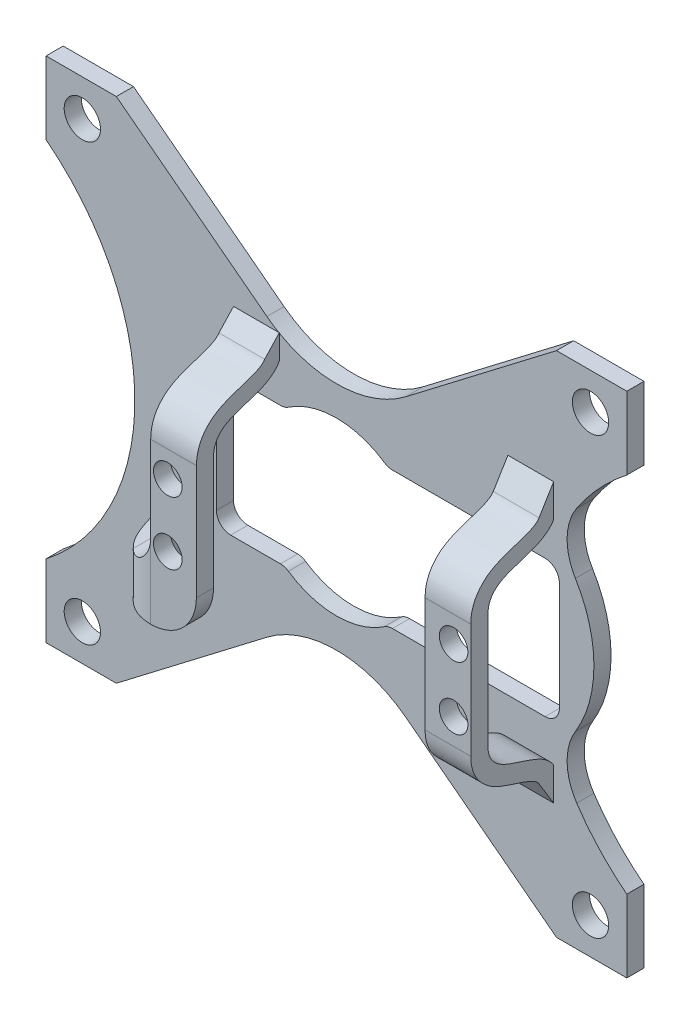
from build123d import *

# Parameters (mm, degrees)
SKETCH1_R           = 3.175
BOSS_EXTRUDE1_DEPTH = 3
SKETCH2_W           = 20
SKETCH2_H           = 3
BOSS_EXTRUDE2_DEPTH = 8
SKETCH3_W           = 3
SKETCH3_H           = 10
BOSS_EXTRUDE3_DEPTH = 8
BOSS_EXTRUDE4_DEPTH = 3
BOSS_EXTRUDE5_DEPTH = 8
FILLET1_START       = 9.218775709
FILLET1_DEPTH       = 8.281224391
FILLET1_START_2     = -10
FILLET1_2_DEPTH     = 6
FILLET2_R           = 2.5
SKETCH6_R           = 2.5
CUT_EXTRUDE1_DEPTH  = 10


with BuildPart() as part:
    # Sketch1 → Boss-Extrude1 (new body)
    with BuildSketch(Plane.XY):
        with BuildLine():
            Line((-60.325, -31.75), (-60.325, -44.45))
            Line((-60.325, -44.45), (-48.025, -44.45))
            Line((-48.025, -44.45), (-21.676299295, -24.294954915))
            ThreePointArc((-21.676299295, -24.294954915), (-9.525, -20.180354672), (2.626299295, -24.294954915))
            Line((2.626299295, -24.294954915), (28.975, -44.45))
            Line((28.975, -44.45), (41.275, -44.45))
            Line((41.275, -44.45), (41.275, -31.75))
            ThreePointArc((41.275, -31.75), (36.515027492, -27.39513634), (32.512762317, -22.33509195))
            ThreePointArc((32.512762317, -22.33509195), (30.830682399, -16.998296592), (32.278938689, -11.593360767))
            ThreePointArc((32.278938689, -11.593360767), (35.521007508, 0), (32.278938689, 11.593360767))
            ThreePointArc((32.278938689, 11.593360767), (30.830682399, 16.998296592), (32.512762317, 22.33509195))
            ThreePointArc((32.512762317, 22.33509195), (36.515027492, 27.39513634), (41.275, 31.75))
            Line((41.275, 31.75), (41.275, 44.45))
            Line((41.275, 44.45), (28.975, 44.45))
            Line((28.975, 44.45), (2.626299295, 24.294954915))
            ThreePointArc((2.626299295, 24.294954915), (-9.525, 20.180354672), (-21.676299295, 24.294954915))
            Line((-21.676299295, 24.294954915), (-48.025, 44.45))
            Line((-48.025, 44.45), (-60.325, 44.45))
            Line((-60.325, 44.45), (-60.325, 31.75))
            ThreePointArc((-60.325, 31.75), (-48.881491961, 17.673557002), (-44.789364565, 0))
            ThreePointArc((-44.789364565, 0), (-48.881491961, -17.673557002), (-60.325, -31.75))
        make_face()
        with Locations((-53.975, -38.1)):
            Circle(SKETCH1_R, mode=Mode.SUBTRACT)
        with Locations((34.925, -38.1)):
            Circle(SKETCH1_R, mode=Mode.SUBTRACT)
        with Locations((-53.975, 38.1)):
            Circle(SKETCH1_R, mode=Mode.SUBTRACT)
        with BuildLine():
            Line((-18.525, -12), (-30.525, -12))
            Line((-30.525, -12), (-30.525, 12))
            Line((-30.525, 12), (-18.525, 12))
            ThreePointArc((-18.525, 12), (-9.525, 15), (-0.525, 12))
            Line((-0.525, 12), (29.475, 12))
            Line((29.475, 12), (29.475, -12))
            Line((29.475, -12), (-0.525, -12))
            ThreePointArc((-0.525, -12), (-9.525, -15), (-18.525, -12))
        make_face(mode=Mode.SUBTRACT)
        with Locations((34.925, 38.1)):
            Circle(SKETCH1_R, mode=Mode.SUBTRACT)
    extrude(amount=BOSS_EXTRUDE1_DEPTH)

    # Sketch2 → Boss-Extrude2 (add)
    with BuildSketch(Plane.YZ.offset(20.475)):
        with BuildLine():
            Line((10, 17.5), (10, 14.5))
            add(Edge.make_bspline(
                [(10, 14.5), (16.044635902, 14.437929649), (14.184736767, 5.689745318), (18.589920917, 3)],
                knots=[0, 0, 0, 0, 1, 1, 1, 1], degree=3))
            Line((18.589920917, 3), (24.346709493, 3))
            Line((24.346709493, 3), (20.153292557, 5.560443148))
            add(Edge.make_bspline(
                [(10.030804376, 17.499841844), (10.580284275, 17.494199418), (11.690825904, 17.381169352), (13.744868646, 16.699236551), (15.740064205, 15.05007217), (17.01264364, 12.797944804), (17.78675167, 10.651473672), (18.380074772, 8.685818255), (18.969741662, 7.060430969), (19.488563299, 6.172247499), (19.869226233, 5.760648886), (20.051080137, 5.622852657), (20.153292557, 5.560443148)],
                knots=[0, 0, 0, 0, 0.0625, 0.125, 0.25, 0.375, 0.5, 0.625, 0.75, 0.875, 0.9375, 1, 1, 1, 1], degree=3))
            Line((10.030804376, 17.499841844), (10, 17.5))
        make_face()
        with Locations((0, 16)):
            Rectangle(SKETCH2_W, SKETCH2_H)
        with BuildLine():
            add(Edge.make_bspline(
                [(-10, 14.5), (-16.044635902, 14.437929649), (-14.184736767, 5.689745318), (-18.589920917, 3)],
                knots=[0, 0, 0, 0, 1, 1, 1, 1], degree=3))
            Line((-10, 14.5), (-10, 17.5))
            Line((-10, 17.5), (-10.030804376, 17.499841844))
            add(Edge.make_bspline(
                [(-10.030804376, 17.499841844), (-10.580284275, 17.494199418), (-11.690825904, 17.381169352), (-13.744868646, 16.699236551), (-15.740064205, 15.05007217), (-17.01264364, 12.797944804), (-17.78675167, 10.651473672), (-18.380074772, 8.685818255), (-18.969741662, 7.060430969), (-19.488563299, 6.172247499), (-19.869226233, 5.760648886), (-20.051080137, 5.622852657), (-20.153292557, 5.560443148)],
                knots=[0, 0, 0, 0, 0.0625, 0.125, 0.25, 0.375, 0.5, 0.625, 0.75, 0.875, 0.9375, 1, 1, 1, 1], degree=3))
            Line((-20.153292557, 5.560443148), (-24.346709493, 3))
            Line((-24.346709493, 3), (-18.589920917, 3))
        make_face()
    extrude(amount=BOSS_EXTRUDE2_DEPTH)

    # Sketch3 → Boss-Extrude3 (add)
    with BuildSketch(Plane.ZY.offset(19.525)):
        with Locations((16, 5)):
            Rectangle(SKETCH3_W, SKETCH3_H)
        with Locations((16, -5)):
            Rectangle(SKETCH3_W, SKETCH3_H)
        with BuildLine():
            add(Edge.make_bspline(
                [(14.5, 10), (14.31563917, 16.035707977), (5.493486467, 14.05293238), (3, 18.609732698)],
                knots=[0, 0, 0, 0, 1, 1, 1, 1], degree=3))
            Line((14.5, 10), (17.5, 10))
            Line((17.5, 10), (17.491030171, 10.04523587))
            add(Edge.make_bspline(
                [(17.491030171, 10.04523587), (17.485387745, 10.594715769), (17.372357679, 11.705257398), (16.690424877, 13.75930014), (15.041260496, 15.754495699), (12.789133131, 17.027075134), (10.642661999, 17.801183164), (8.677006582, 18.394506266), (7.051619296, 18.984173156), (6.163435825, 19.502994793), (5.751837213, 19.883657727), (5.614040983, 20.065511631), (5.551631475, 20.167724051)],
                knots=[0, 0, 0, 0, 0.0625, 0.125, 0.25, 0.375, 0.5, 0.625, 0.75, 0.875, 0.9375, 1, 1, 1, 1], degree=3))
            Line((5.551631475, 20.167724051), (3, 22.905906895))
            Line((3, 22.905906895), (3, 18.609732698))
        make_face()
    extrude(amount=BOSS_EXTRUDE3_DEPTH)

    # Sketch4 → Boss-Extrude4 (add)
    with BuildSketch(Plane(origin=(0, 0, 14.5), x_dir=(-1, 0, 0), z_dir=(0, 0, -1))):
        with BuildLine():
            Line((27.525, -18), (27.525, -10))
            Line((27.525, -10), (19.525, -10))
            ThreePointArc((19.525, -10), (21.868145751, -15.656854249), (27.525, -18))
        make_face()
    extrude(amount=-BOSS_EXTRUDE4_DEPTH)

    # Sketch5 → Boss-Extrude5 (add)
    with BuildSketch(Plane.XZ.offset(10)):
        with BuildLine():
            Line((-37.647488181, 5.560601304), (-40.424026667, 3.033030687))
            Line((-40.424026667, 3.033030687), (-36.12785247, 3.033030687))
            add(Edge.make_bspline(
                [(-27.525, 14.5), (-33.57036544, 14.381422519), (-31.574084791, 5.518855921), (-36.12785247, 3.033030687)],
                knots=[0, 0, 0, 0, 1, 1, 1, 1], degree=3))
            Line((-27.525, 14.5), (-27.525, 17.5))
            add(Edge.make_bspline(
                [(-27.525, 17.5), (-28.074479899, 17.494357574), (-29.185021529, 17.381327508), (-31.23906427, 16.699394706), (-33.234259829, 15.050230325), (-34.506839264, 12.79810296), (-35.280947294, 10.651631828), (-35.874270396, 8.685976411), (-36.463937286, 7.060589125), (-36.982758923, 6.172405654), (-37.363421857, 5.760807042), (-37.545275761, 5.623010812), (-37.647488181, 5.560601304)],
                knots=[0, 0, 0, 0, 0.0625, 0.125, 0.25, 0.375, 0.5, 0.625, 0.75, 0.875, 0.9375, 1, 1, 1, 1], degree=3))
        make_face()
    extrude(amount=BOSS_EXTRUDE5_DEPTH)

    # Fillet1: read off the stored shape, not the designer's step
    # Fillet1 outline → Fillet1 (add)
    with BuildSketch(Plane.XY.offset(FILLET1_START)):
        with BuildLine():
            Line((-27.525, -10), (-27.525, -5))
            ThreePointArc((-27.525, -5), (-28.989466094, -8.535533906), (-32.525, -10))
            Line((-32.525, -10), (-27.525, -10))
        make_face()
    extrude(amount=FILLET1_DEPTH)

    # Fillet1 2 outline → Fillet1 2 (cut)
    with BuildSketch(Plane(origin=(0, 0, 0), x_dir=(1, 0, 0), z_dir=(0, 1, 0)).offset(FILLET1_START_2)):
        with BuildLine():
            Line((-32.525, -17.5000001), (-27.525, -17.5))
            add(Edge.make_bspline(
                [(-27.525, -17.5), (-28.074479899, -17.494357574), (-29.185021529, -17.381327508), (-30.968007207, -16.789384412), (-32.004283714, -16.043301537), (-32.525, -15.550477548)],
                knots=[0, 0, 0, 0, 0.0625, 0.125, 0.217009321, 0.217009321, 0.217009321, 0.217009321], degree=3))
            Line((-32.525, -15.550477548), (-32.525, -17.5000001))
        make_face()
        with BuildLine():
            Line((-27.525, -9.218775709), (-32.525000028, -9.218775718))
            add(Edge.make_bspline(
                [(-32.525000028, -9.218775718), (-31.668443392, -11.933356908), (-30.719340028, -14.437344269), (-27.525, -14.5)],
                knots=[0.47160514, 0.47160514, 0.47160514, 0.47160514, 1, 1, 1, 1], degree=3))
            Line((-27.525, -14.5), (-27.525, -9.218775709))
        make_face()
    extrude(amount=FILLET1_2_DEPTH, mode=Mode.SUBTRACT)

    # Fillet2
    fillet2_edges = [part.edges().sort_by_distance(p)[0] for p in [
        (-18.525, 12, 1.5),
        (-30.525, 12, 1.5),
        (-30.525, -12, 1.5),
        (-18.525, -12, 1.5),
        (-0.525, -12, 1.5),
        (29.475, -12, 1.5),
        (29.475, 12, 1.5),
        (-0.525, 12, 1.5),
    ]]
    fillet(fillet2_edges, radius=FILLET2_R)

    # Sketch6 → Cut-Extrude1 (cut)
    with BuildSketch(Plane(origin=(0, 0, 14.5), x_dir=(-1, 0, 0), z_dir=(0, 0, -1))):
        with Locations(Location((24.525, -5.5, 0), (0, 0, 90))):
            Circle(SKETCH6_R)
        with Locations(Location((24.525, 5.5, 0), (0, 0, 90))):
            Circle(SKETCH6_R)
        with Locations(Location((-25.475, -5.5, 0), (0, 0, 90))):
            Circle(SKETCH6_R)
        with Locations(Location((-25.475, 5.5, 0), (0, 0, 90))):
            Circle(SKETCH6_R)
    extrude(amount=-CUT_EXTRUDE1_DEPTH, mode=Mode.SUBTRACT)


solid = part.part
